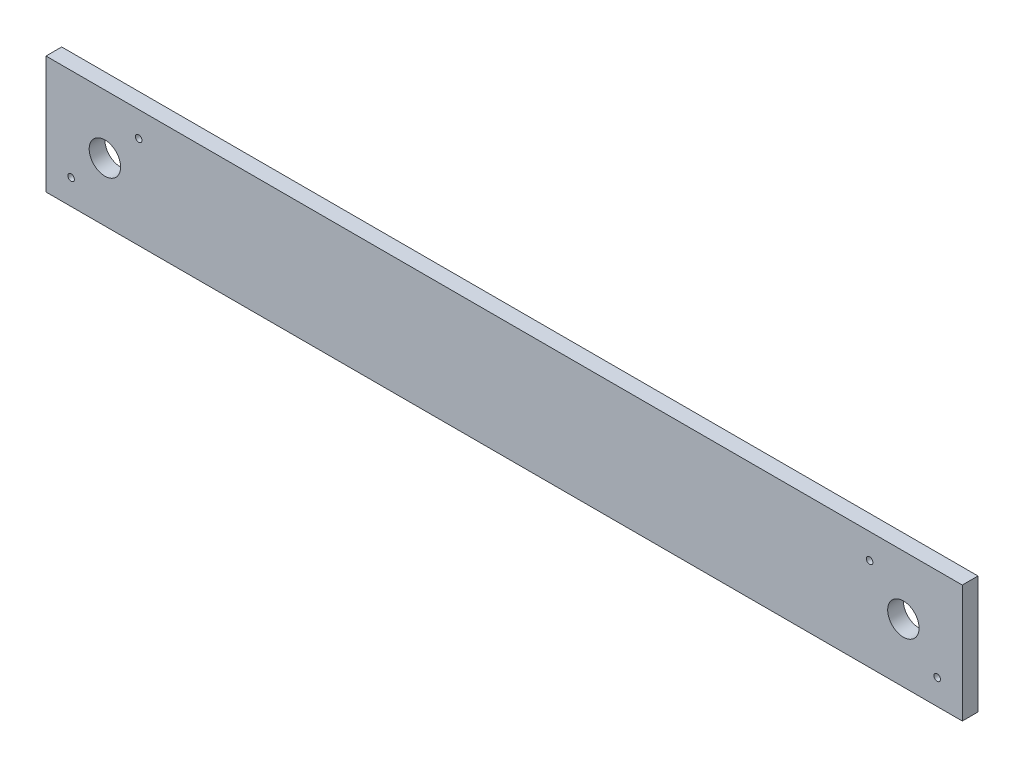
from build123d import *

# Parameters (mm, degrees)
CROQUIS1_W              = 350
CROQUIS1_H              = 45
SALIENTE_EXTRUIR1_DEPTH = 6
CROQUIS2_R              = 6
CROQUIS2_R_2            = 1.25
CORTAR_EXTRUIR1_DEPTH   = 353.932004783


with BuildPart() as part:
    # Croquis1 → Saliente-Extruir1 (new body)
    with BuildSketch(Plane.XY):
        with Locations((-175, -22.5)):
            Rectangle(CROQUIS1_W, CROQUIS1_H)
    extrude(amount=SALIENTE_EXTRUIR1_DEPTH)

    # Croquis2 → Cortar-Extruir1 (cut, through all)
    with BuildSketch(Plane.XY.offset(6)):
        with Locations((-327.5, -22.5)):
            Circle(CROQUIS2_R)
        with Locations((-22.5, -22.5)):
            Circle(CROQUIS2_R)
        with Locations((-314.595301243, -9.595301243)):
            Circle(CROQUIS2_R_2)
        with Locations((-340.404698757, -35.404698757)):
            Circle(CROQUIS2_R_2)
        with Locations((-35.404698757, -9.595301243)):
            Circle(CROQUIS2_R_2)
        with Locations((-9.595301243, -35.404698757)):
            Circle(CROQUIS2_R_2)
    extrude(amount=-CORTAR_EXTRUIR1_DEPTH, mode=Mode.SUBTRACT)


solid = part.part
